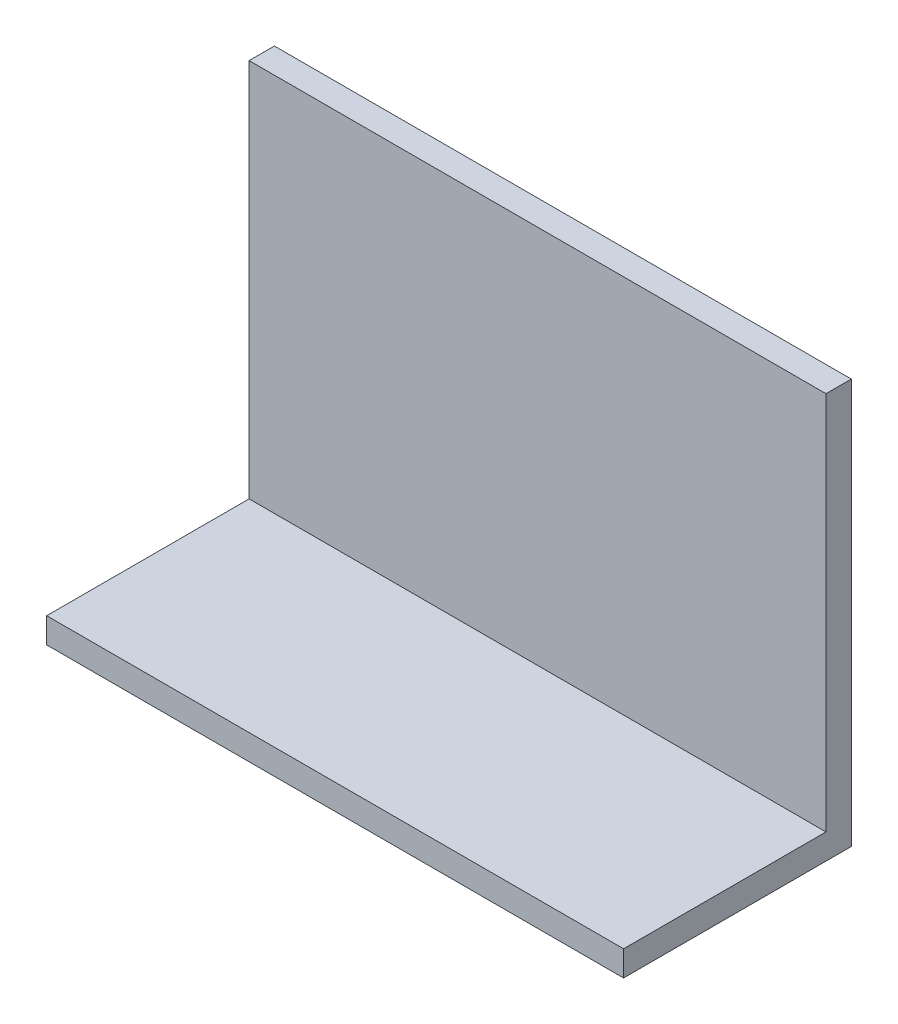
from build123d import *

# Parameters (mm, degrees)
SKETCH_1_W      = 114
SKETCH_1_H      = 40
EXTRUDE_1_DEPTH = 5
SKETCH_2_W      = 114
SKETCH_2_H      = 80
EXTRUDE_2_DEPTH = 5


with BuildPart() as part:
    # ｽｹｯﾁ1 → ﾎﾞｽ - 押し出し1 (new body)
    with BuildSketch(Plane(origin=(0, 0, 0), x_dir=(1, 0, 0), z_dir=(0, 1, 0))):
        Rectangle(SKETCH_1_W, SKETCH_1_H)
    extrude(amount=EXTRUDE_1_DEPTH)

    # ｽｹｯﾁ2 → ﾎﾞｽ - 押し出し2 (add)
    with BuildSketch(Plane(origin=(0, 0, -20), x_dir=(-1, 0, 0), z_dir=(0, 0, -1))):
        with Locations((0, 40)):
            Rectangle(SKETCH_2_W, SKETCH_2_H)
    extrude(amount=EXTRUDE_2_DEPTH)


solid = part.part
